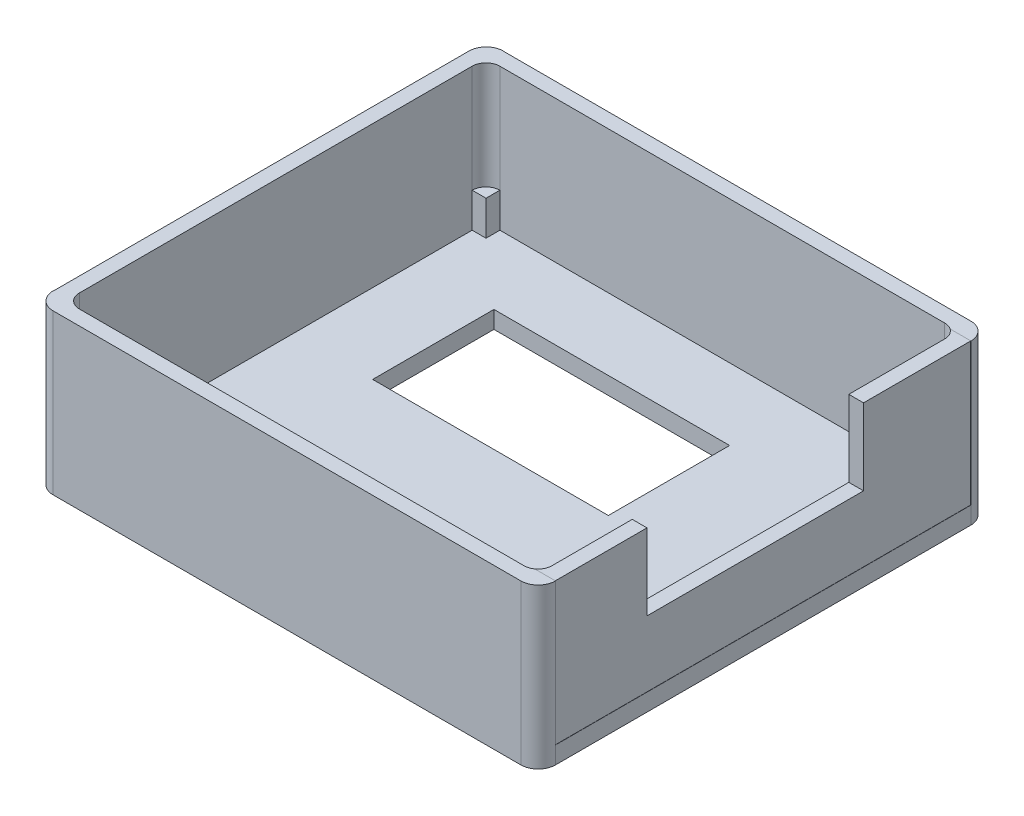
from build123d import *

# Parameters (mm, degrees)
SKETCH_1_W          = 29.00004826
SKETCH_1_H          = 8.2
EXTRUDE_1_DEPTH     = 1
SKETCH_3_W          = 24.987345695
SKETCH_3_H          = 8.2
EXTRUDE_2_DEPTH     = 1
SKETCH_4_W          = 27.987350775
SKETCH_4_H          = 8.2
EXTRUDE_3_DEPTH     = 1
SKETCH_6_W          = 23.983586282
SKETCH_6_H          = 8.2
EXTRUDE_4_DEPTH     = 1
SKETCH_9_W          = 12.5
SKETCH_9_H          = 4.4
CUT_EXTRUDE_1_DEPTH = 1
SKETCH_10_W         = 29.00004826
SKETCH_10_H         = 25.974648209
EXTRUDE_5_DEPTH     = 1
SKETCH_11_W         = 13.604013208
SKETCH_11_H         = 7
CUT_EXTRUDE_3_DEPTH = 1
FILLET_1_R          = 1
FILLET_2_R          = 1
CUT_EXTRUDE_START   = -8.200051
SKETCH_12_W         = 27.27465329
SKETCH_12_H         = 24.274648209
SKETCH_12_W_2       = 26.97465329
SKETCH_12_H_2       = 23.974648209
CUT_EXTRUDE_4_DEPTH = 8.200051
EXTRUDE_START       = -5.1e-05
SKETCH_14_W         = 0.8
SKETCH_14_H         = 0.8
EXTRUDE_6_DEPTH     = 2
FILLET_3_R          = 0.8


# Some blends are built 0.0001 mm under size
with BuildPart() as part:
    # 草图1 → 凸台-拉伸1 (new body)
    with BuildSketch(Plane.XY):
        with Locations((-13.373026416, 0.4999492)):
            Rectangle(SKETCH_1_W, SKETCH_1_H)
    extrude(amount=EXTRUDE_1_DEPTH)

    # 草图3 → 凸台-拉伸2 (add)
    with BuildSketch(Plane.ZY.offset(26.860353061)):
        with Locations((-12.493672848, 0.4999492)):
            Rectangle(SKETCH_3_W, SKETCH_3_H)
    extrude(amount=EXTRUDE_2_DEPTH)

    # 草图4 → 凸台-拉伸3 (add)
    with BuildSketch(Plane(origin=(0, 0, -23.974648209), x_dir=(-1, 0, 0), z_dir=(0, 0, -1))):
        with Locations((12.866677673, 0.4999492)):
            Rectangle(SKETCH_4_W, SKETCH_4_H)
    extrude(amount=EXTRUDE_3_DEPTH)

    # 草图6 → 凸台-拉伸4 (add)
    with BuildSketch(Plane(origin=(0.114300229, 0, 0), x_dir=(0, 0, -1), z_dir=(1, 0, 0))):
        with Locations((11.991793141, 0.5)):
            Rectangle(SKETCH_6_W, SKETCH_6_H)
    extrude(amount=EXTRUDE_4_DEPTH)

    # 草图9 → 切除-拉伸1 (cut)
    with BuildSketch(Plane(origin=(1.114300229, 0, 0), x_dir=(0, 0, -1), z_dir=(1, 0, 0))):
        with Locations((11.541221742, 2.4)):
            Rectangle(SKETCH_9_W, SKETCH_9_H)
    extrude(amount=-CUT_EXTRUDE_1_DEPTH, mode=Mode.SUBTRACT)

    # 草图10 → 凸台-拉伸5 (add)
    with BuildSketch(Plane.XZ.offset(3.6)):
        with Locations((-13.373026416, -11.987324105)):
            Rectangle(SKETCH_10_W, SKETCH_10_H)
    extrude(amount=EXTRUDE_5_DEPTH)

    # 草图11 → 切除-拉伸3 (cut)
    with BuildSketch(Plane.XZ.offset(4.6)):
        with Locations((-15.621031242, -16.494333249)):
            Rectangle(SKETCH_11_W, SKETCH_11_H)
    extrude(amount=-CUT_EXTRUDE_3_DEPTH, mode=Mode.SUBTRACT)

    # 圆角1
    fillet_1_edges = [part.edges().sort_by_distance(p)[0] for p in [
        (1.126997714, -2.54e-05, -24.974648209),
        (1.126997714, -2.54e-05, 1),
        (-27.873050546, -2.54e-05, 1),
        (-27.873050546, -4.1, -24.974648209),
    ]]
    fillet(fillet_1_edges, radius=FILLET_1_R)

    # 圆角2
    fillet_2_edges = [part.edges().sort_by_distance(p)[0] for p in [
        (-27.860353061, 0.4999492, -24.987345695),
    ]]
    fillet(fillet_2_edges, radius=FILLET_2_R - 0.0001)  # a hair under: the kernel refuses the full size

    # 草图12 → 切除-拉伸4 (cut)
    with BuildSketch(Plane(origin=(0, 4.6, 0), x_dir=(1, 0, 0), z_dir=(0, 1, 0)).offset(CUT_EXTRUDE_START)):
        with Locations((-13.373026416, 11.987324105)):
            Rectangle(SKETCH_12_W, SKETCH_12_H)
        with Locations((-13.373026416, 11.987324105)):
            Rectangle(SKETCH_12_W_2, SKETCH_12_H_2, mode=Mode.SUBTRACT)
    extrude(amount=CUT_EXTRUDE_4_DEPTH, mode=Mode.SUBTRACT)

    # 草图14 → 凸台-拉伸6 (add)
    with BuildSketch(Plane(origin=(0, -3.6, 0), x_dir=(1, 0, 0), z_dir=(0, 1, 0)).offset(EXTRUDE_START)):
        with Locations((-26.610353061, 23.724648209)):
            Rectangle(SKETCH_14_W, SKETCH_14_H)
        with Locations((-0.135699771, 0.25)):
            Rectangle(SKETCH_14_W, SKETCH_14_H)
    extrude(amount=EXTRUDE_6_DEPTH)

    # 圆角3
    # the kernel refuses this fillet: 0.8 mm, written as the material it adds along each edge
    with BuildSketch(Plane(origin=(-27.010353061, -3.600051, 0.15), x_dir=(0, 0, -1), z_dir=(0, 1, 0)), Plane(origin=(-27.010353061, -3.600051, -24.124648209), x_dir=(1, 0, 0), z_dir=(0, 1, 0))) as fillet_3_piece_1:
        with BuildLine():
            CenterArc((FILLET_3_R, -FILLET_3_R), FILLET_3_R, 90, 90)
            Line((0, -FILLET_3_R), (0, 0))
            Line((0, 0), (FILLET_3_R, 0))
        make_face()
    extrude(amount=8.2000002)
    with BuildSketch(Plane(origin=(0.264300229, -3.600051, 0.15), x_dir=(0, 0, -1), z_dir=(0, 1, 0))) as fillet_3_piece_2_section:
        with BuildLine():
            CenterArc((FILLET_3_R, FILLET_3_R), FILLET_3_R, 180, 90)
            Line((0, FILLET_3_R), (0, 0))
            Line((0, 0), (FILLET_3_R, 0))
        make_face()
    fillet_3_piece_2 = extrude(amount=10.2000002, mode=Mode.PRIVATE)
    fillet_3_piece_2 = split(fillet_3_piece_2, bisect_by=Plane(origin=(0.183426008, 4.6, -0.178427163), z_dir=(0, -1, 0)), keep=Keep.TOP, mode=Mode.PRIVATE)
    add(fillet_3_piece_2)
    with BuildSketch(Plane(origin=(0.264300229, -3.600051, -24.124648209), x_dir=(0, 0, 1), z_dir=(0, 1, 0))) as fillet_3_piece_3_section:
        with BuildLine():
            CenterArc((FILLET_3_R, -FILLET_3_R), FILLET_3_R, 90, 90)
            Line((0, -FILLET_3_R), (0, 0))
            Line((0, 0), (FILLET_3_R, 0))
        make_face()
    fillet_3_piece_3 = extrude(amount=10.2000002, mode=Mode.PRIVATE)
    fillet_3_piece_3 = split(fillet_3_piece_3, bisect_by=Plane(origin=(0.180139074, 4.6, -23.803633202), z_dir=(0, -1, 0)), keep=Keep.TOP, mode=Mode.PRIVATE)
    add(fillet_3_piece_3)


solid = part.part
